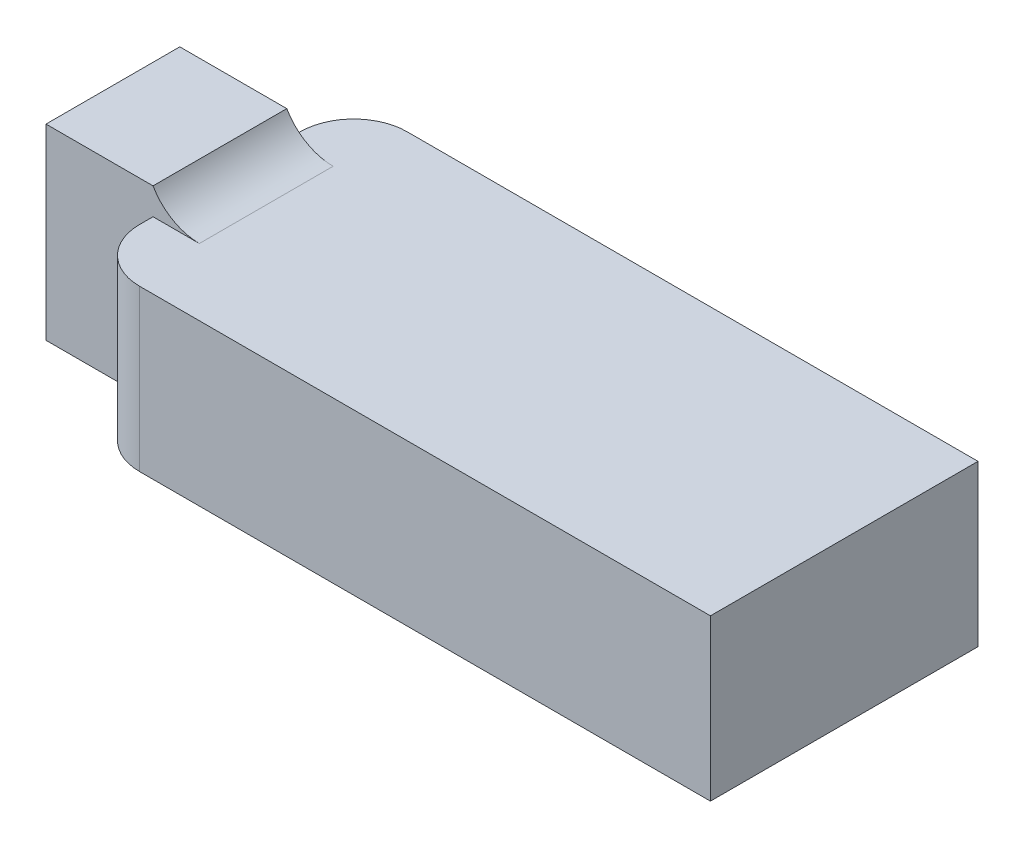
from build123d import *

# Parameters (mm, degrees)
SKETCH_1_W      = 70
SKETCH_1_H      = 30
EXTRUDE_1_DEPTH = 18
FILLET_1_R      = 6
SKETCH_2_W      = 15
SKETCH_2_H      = 3
SKETCH_2_H_2    = 18
EXTRUDE_2_DEPTH = 12
FILLET_2_R      = 6


with BuildPart() as part:
    # 草图1 → 凸台-拉伸1 (new body)
    with BuildSketch(Plane(origin=(0, 0, 0), x_dir=(1, 0, 0), z_dir=(0, 1, 0))):
        Rectangle(SKETCH_1_W, SKETCH_1_H)
    extrude(amount=EXTRUDE_1_DEPTH)

    # 圆角1
    fillet_1_edges = [part.edges().sort_by_distance(p)[0] for p in [
        (-35, 9, 15),
        (-35, 9, -15),
    ]]
    fillet(fillet_1_edges, radius=FILLET_1_R)

    # 草图2 → 凸台-拉伸2 (add)
    with BuildSketch(Plane.ZY.offset(35)):
        with Locations((0, 19.5)):
            Rectangle(SKETCH_2_W, SKETCH_2_H)
        with Locations((0, 9)):
            Rectangle(SKETCH_2_W, SKETCH_2_H_2)
    extrude(amount=EXTRUDE_2_DEPTH)

    # 圆角2
    # the kernel refuses this fillet: 6 mm, written as the material it adds along each edge
    with BuildSketch(Plane(origin=(-35, 18, 7.5), x_dir=(1, 0, 0), z_dir=(0, 0, -1))) as fillet_2_piece_1:
        with BuildLine():
            CenterArc((5.196152423, -6), FILLET_2_R, 90, 60)
            Line((0, -3), (0, 0))
            Line((0, 0), (5.196152423, 0))
        make_face()
    extrude(amount=15)


solid = part.part
